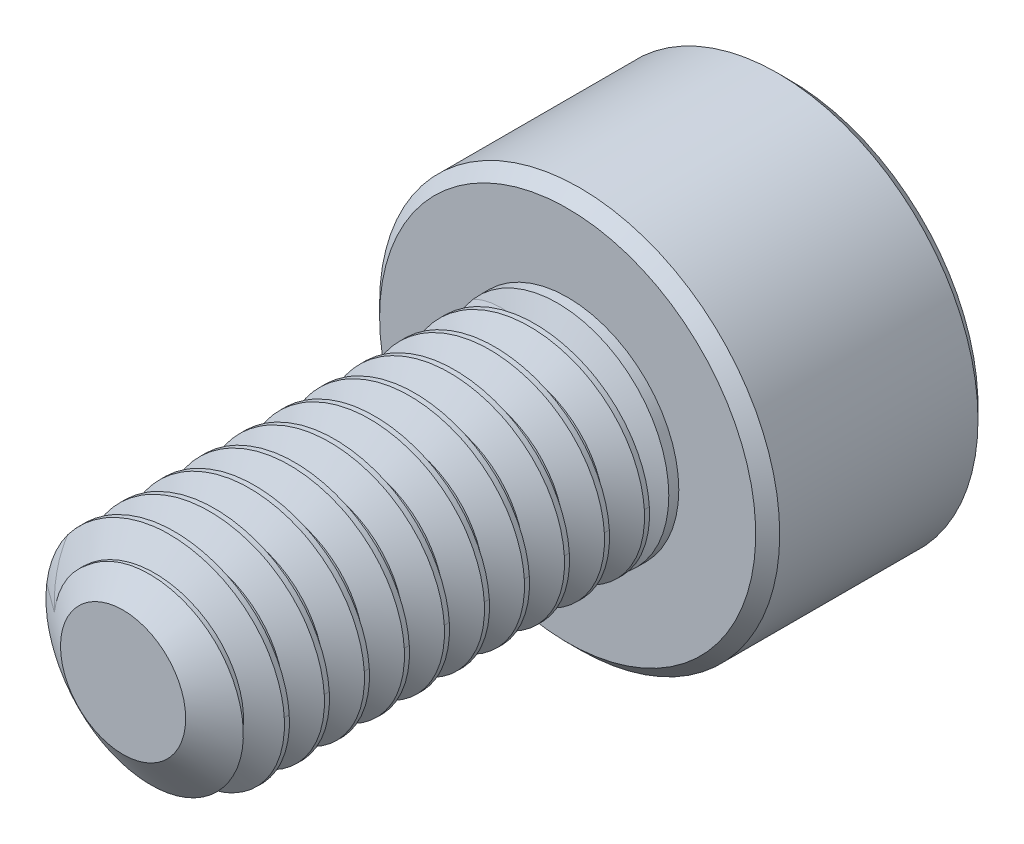
from build123d import *

# Parameters (mm, degrees)
SKETCH1_R          = 1.25
EXTRUDE1_DEPTH     = 5
CUT_SWEEP1_PITCH   = 0.45
SKETCH6_R          = 2.25
EXTRUDE2_DEPTH     = 2.5
CUT_EXTRUDE1_DEPTH = 1.5
CHAMFER1_SIZE      = 0.135


with BuildPart() as part:
    # Sketch1 → Extrude1 (new body)
    with BuildSketch(Plane.XY):
        Circle(SKETCH1_R)
    extrude(amount=-EXTRUDE1_DEPTH)

    # Cut-Sweep1: the profile of Sketch3 profile screwed along a right-hand helix of 12.111111 turns, 6 arcs to a turn; built about Z, then put on its axis
    cut_sweep1_z = Axis((0, 0, 0), (0, 0, 1))
    cut_sweep1_corners = [(1.2503, 0, -0.393923205), (0.957716426, 0, -0.225), (0.957716426, 0, -0.16875), (1.2503, 0, 0.000173205)]
    with BuildLine(mode=Mode.PRIVATE) as cut_sweep1_profile:
        Line(cut_sweep1_corners[0], cut_sweep1_corners[1])
        Line(cut_sweep1_corners[1], cut_sweep1_corners[2])
        Line(cut_sweep1_corners[2], cut_sweep1_corners[3])
        Line(cut_sweep1_corners[3], cut_sweep1_corners[0])
    cut_sweep1_cap = Face(cut_sweep1_profile.wire())
    cut_sweep1_turn_angles = [0, 30, 60, 90, 120, 150, 180, 210, 240, 270, 300, 330, 360]
    cut_sweep1_turn_weights = [1, 0.8660254037844387, 1, 0.8660254037844387, 1, 0.8660254037844387, 1, 0.8660254037844387, 1, 0.8660254037844387, 1, 0.8660254037844387, 1]
    cut_sweep1_turn_rails = [Edge.make_bspline([Vector(p[0], p[1], 0).rotate(cut_sweep1_z, cut_sweep1_turn_angles[k]) / cut_sweep1_turn_weights[k] + Vector(0, 0, p[2] + CUT_SWEEP1_PITCH * cut_sweep1_turn_angles[k] / 360) for k in range(13)], [0, 0, 0, 1, 1, 2, 2, 3, 3, 4, 4, 5, 5, 6, 6, 6], 2, cut_sweep1_turn_weights) for p in cut_sweep1_corners]
    cut_sweep1_turn_sides = [Face.make_surface_from_curves(cut_sweep1_turn_rails[p[0]], cut_sweep1_turn_rails[p[1]]) for p in [(0, 1), (1, 2), (2, 3), (3, 0)]]
    cut_sweep1_last_angles = [4320, 4340, 4360]
    cut_sweep1_last_weights = [1, 0.9396926207859084, 1]
    cut_sweep1_last_rails = [Edge.make_bspline([Vector(p[0], p[1], 0).rotate(cut_sweep1_z, cut_sweep1_last_angles[k]) / cut_sweep1_last_weights[k] + Vector(0, 0, p[2] + CUT_SWEEP1_PITCH * cut_sweep1_last_angles[k] / 360) for k in range(3)], [0, 0, 0, 1, 1, 1], 2, cut_sweep1_last_weights) for p in cut_sweep1_corners]
    cut_sweep1_last_sides = [Face.make_surface_from_curves(cut_sweep1_last_rails[p[0]], cut_sweep1_last_rails[p[1]]) for p in [(0, 1), (1, 2), (2, 3), (3, 0)]]
    cut_sweep1 = Plane(origin=(0, 0, 0), x_dir=(0, 1, 0), z_dir=(0, 0, -1)) * Solid(Shell([*[p.moved(Location((0, 0, CUT_SWEEP1_PITCH * i))) for i in range(12) for p in cut_sweep1_turn_sides], *cut_sweep1_last_sides, cut_sweep1_cap, cut_sweep1_cap.rotate(cut_sweep1_z, 4360).moved(Location((0, 0, CUT_SWEEP1_PITCH * 4360 / 360)))]))
    add(cut_sweep1, mode=Mode.SUBTRACT)

    # Sketch4 → Cut-Revolve1 (revolve, cut)
    with BuildSketch(Plane(origin=(0, 0, 0), x_dir=(0, 0, -1), z_dir=(1, 0, 0)), mode=Mode.PRIVATE) as cut_revolve1_sk:
        Polygon((0.382511876, 1.25), (0, 0.703716426), (0, 1.25), align=None)
    revolve(cut_revolve1_sk.sketch.rotate(Axis((0, 0, 0), (0, 0, -1)), 276.971148597), axis=Axis((0, 0, 0), (0, 0, -1)), mode=Mode.SUBTRACT)

    # Sketch6 → Extrude2 (add)
    with BuildSketch(Plane(origin=(0, 0, -5), x_dir=(-1, 0, 0), z_dir=(0, 0, -1))):
        Circle(SKETCH6_R)
    extrude(amount=EXTRUDE2_DEPTH)

    # Sketch7 → Cut-Extrude1 (cut)
    with BuildSketch(Plane(origin=(0, 0, -7.5), x_dir=(-1, 0, 0), z_dir=(0, 0, -1))):
        Polygon((0, 1.154700538), (-1, 0.577350269), (-1, -0.577350269), (0, -1.154700538), (1, -0.577350269), (1, 0.577350269), align=None)
    extrude(amount=-CUT_EXTRUDE1_DEPTH, mode=Mode.SUBTRACT)

    # Cut-Extrude2 cone 1 section (through the dimple's axis) → Cut-Extrude2 (revolve, cut)
    with BuildSketch(Plane(origin=(0, 0, -7.5), x_dir=(0, 1, 0), z_dir=(1, 0, 0))):
        Polygon((0, 0), (1.154700538, 0), (0, 1.154700538), align=None)
    revolve(axis=Axis((0, 0, -7.5), (0, 0, 1)), mode=Mode.SUBTRACT)

    # Chamfer1
    chamfer1_edges = [part.edges().sort_by_distance(p)[0] for p in [
        (2.25, 0, -5),
        (2.25, 0, -7.5),
    ]]
    chamfer(chamfer1_edges, length=CHAMFER1_SIZE)

    # Sketch10 → Revolve1 (revolve)
    with BuildSketch(Plane(origin=(0, 0, 0), x_dir=(0, 0, -1), z_dir=(1, 0, 0)), mode=Mode.PRIVATE) as revolve1_sk:
        Polygon((5, 1.25), (5, 0), (4.369733047, 0), (4.8875, 1.25), align=None)
    revolve(revolve1_sk.sketch.rotate(Axis((0, 0, -5), (0, 0, 1)), 270), axis=Axis((0, 0, -5), (0, 0, 1)))


solid = part.part
